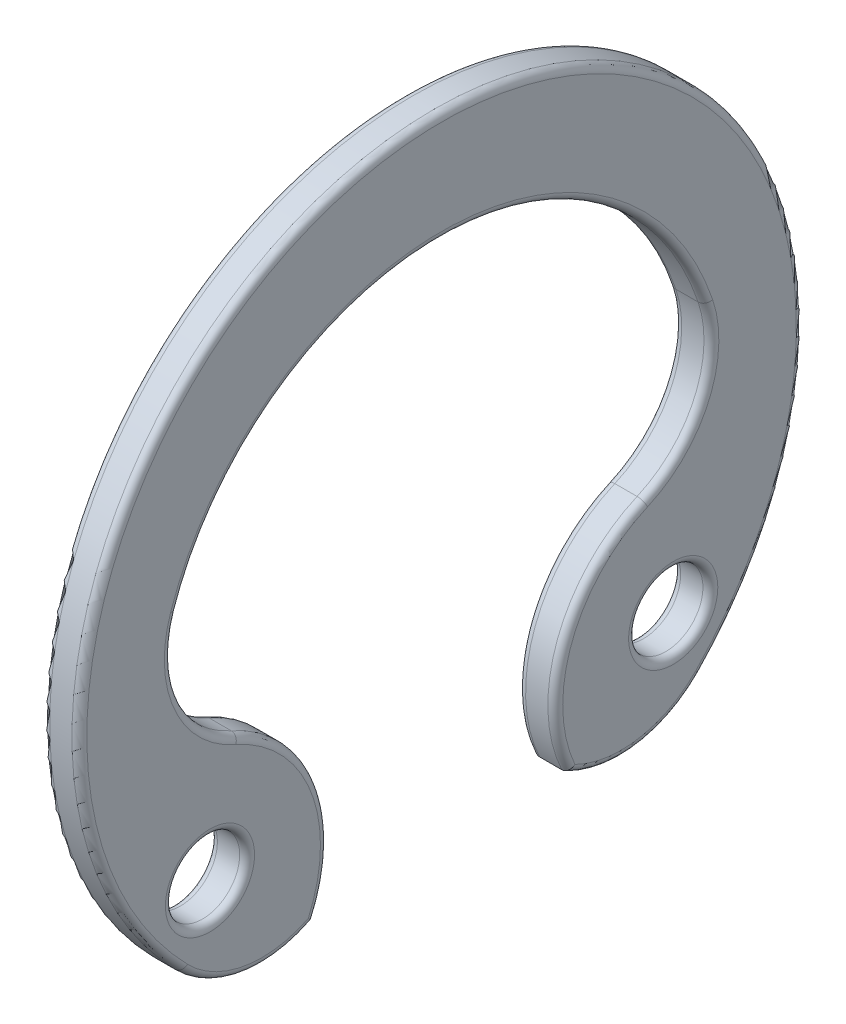
from build123d import *

# Parameters (mm, degrees)
SKETCH_1_R      = 1
EXTRUDE_1_DEPTH = 1
FILLET_1_R      = 3
FILLET_2_R      = 0.2


with BuildPart() as part:
    # 草图1 → 凸台-拉伸1 (new body)
    with BuildSketch(Plane(origin=(0, 0, 0), x_dir=(0, 0, -1), z_dir=(1, 0, 0))):
        with BuildLine():
            Line((3.435285805, -7.366994183), (4.120528052, -8.836500924))
            ThreePointArc((4.120528052, -8.836500924), (0, 9.75), (-4.120528052, -8.836500924))
            Line((-4.120528052, -8.836500924), (-3.435285805, -7.366994183))
            ThreePointArc((-3.435285805, -7.366994183), (-3.791037727, -3.372067711), (-7.433841702, -1.693980661))
            ThreePointArc((-7.433841702, -1.693980661), (0, 6.8), (7.433841702, -1.693980661))
            ThreePointArc((7.433841702, -1.693980661), (3.791037727, -3.372067711), (3.435285805, -7.366994183))
        make_face()
        with Locations((6.234824566, -5.012680185)):
            Circle(SKETCH_1_R, mode=Mode.SUBTRACT)
        with Locations(Location((-6.234824566, -5.012680185, 0), (0, 0, 180))):
            Circle(SKETCH_1_R, mode=Mode.SUBTRACT)
    extrude(amount=EXTRUDE_1_DEPTH)

    # 圆角1
    # the kernel refuses this fillet: 3 mm, written as the material it adds along each edge
    with BuildSketch(Plane(origin=(0, -1.693980661, 7.433841702), x_dir=(0, -0.15814273112470859, -0.9874162630787575), z_dir=(1, 0, 0))) as fillet_1_piece_1:
        with BuildLine():
            CenterArc((2.745701077, 2.905039978), FILLET_1_R, 170.432282597, 85.113330195)
            ThreePointArc((-0.212568456, 3.403679497), (-0.302311067, 1.689597373), (0, 0))
            ThreePointArc((0, 0), (0.998436755, 0.126613362), (1.996873511, 0))
        make_face()
    extrude(amount=1)
    with BuildSketch(Plane(origin=(0, -1.693980661, -7.433841702), x_dir=(0, -0.15814273112470806, 0.9874162630787576), z_dir=(1, 0, 0))) as fillet_1_piece_2:
        with BuildLine():
            CenterArc((2.745701077, -2.905039978), FILLET_1_R, 104.454387208, 85.113330195)
            ThreePointArc((-0.212568456, -3.403679497), (-0.302311067, -1.689597373), (0, 0))
            ThreePointArc((0, 0), (0.998436755, -0.126613362), (1.996873511, 0))
        make_face()
    extrude(amount=1)
    # the kernel refuses this fillet: 3 mm, written as the material it takes off along each edge
    with BuildSketch(Plane(origin=(-8.767987991, -8.836500924, -4.120528052), x_dir=(0, 0.906307787036703, 0.42261826174058587), z_dir=(1, 0, 0))) as fillet_1_2_piece_1:
        with BuildLine():
            CenterArc((3.436701236, -2.388463673), FILLET_1_R, 127.23555709, 73.48720666)
            ThreePointArc((0.630790674, -3.450003083), (0.158994033, -1.753597598), (0, 0))
            Line((0, 0), (1.621421289, 0))
        make_face()
    extrude(amount=18.535975981, mode=Mode.SUBTRACT)
    with BuildSketch(Plane(origin=(-8.767987991, -8.836500924, 4.120528052), x_dir=(0, 0.578731633717964, 0.8155180538370297), z_dir=(1, 0, 0))) as fillet_1_2_piece_2:
        with BuildLine():
            CenterArc((2.967626705, -2.951078759), FILLET_1_R, 79.638618125, 73.48720666)
            Line((0.291622613, -1.594980642), (0, 0))
            ThreePointArc((0, 0), (1.753597598, 0.158994033), (3.507195196, 0))
        make_face()
    extrude(amount=18.535975981, mode=Mode.SUBTRACT)

    # 圆角2
    fillet_2_edges = [part.edges().sort_by_distance(p)[0] for p in [
        (0, -5.012680185, -5.234824566),
        (1, -5.012680185, -5.234824566),
        (0, -5.012680185, 5.234824566),
        (1, -4.261103418, 3.319314916),
        (1, -5.012680185, 5.234824566),
        (0, 9.75, 0),
        (1, 9.75, 0),
        (0, -4.261103418, -3.319314916),
        (0, 6.8, 0),
        (0, -7.675618987, 5.301024215),
        (0, -7.675618987, -5.301024215),
        (1, -4.261103418, -3.319314916),
        (1, 6.8, 0),
        (1, -7.675618987, 5.301024215),
        (1, -7.675618987, -5.301024215),
        (0, -0.474647874, 7.006258248),
        (1, -0.474647874, 7.006258248),
        (0, -0.474647874, -7.006258248),
        (1, -0.474647874, -7.006258248),
        (0, -4.261103418, 3.319314916),
    ]]
    fillet(fillet_2_edges, radius=FILLET_2_R)


solid = part.part
